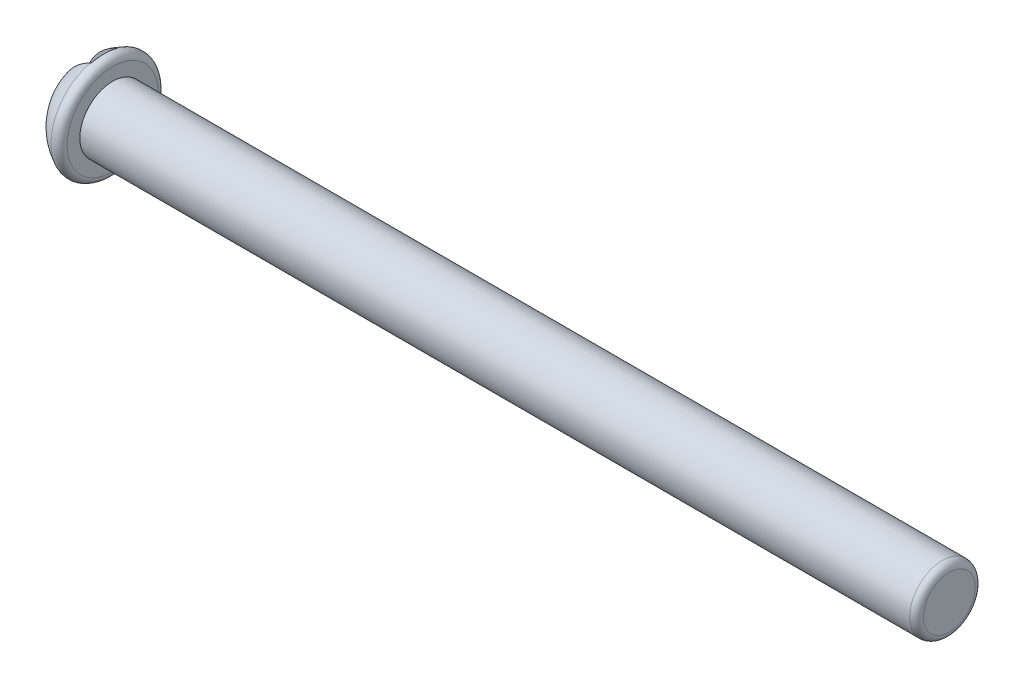
from build123d import *

# Parameters (mm, degrees)
CUT_EXTRUDE1_DEPTH = 1
FILLET1_R          = 0.2


with BuildPart() as part:
    # Sketch1 → Revolve1 (revolve)
    with BuildSketch(Plane(origin=(0, 0, 0), x_dir=(1, 0, 0), z_dir=(0, 1, 0))):
        with BuildLine():
            Line((0, 0), (25.5, 0))
            Line((25.5, 0), (25.5, 0.95))
            Line((25.5, 0.95), (1.25, 0.95))
            Line((1.25, 0.95), (1.25, 1.6))
            ThreePointArc((1.25, 1.6), (0.349547808, 1.015197025), (0, 0))
        make_face()
    revolve(axis=Axis((0, 0, 0), (1, 0, 0)))

    # Sketch2 → Cut-Extrude1 (cut)
    with BuildSketch(Plane(origin=(0, 0, 0), x_dir=(0, 0, -1), z_dir=(1, 0, 0))):
        with BuildLine():
            Line((0.375, -1.925921717), (-0.375, -1.925921717))
            Line((-0.375, -1.925921717), (-0.375, -0.649519053))
            ThreePointArc((-0.375, -0.649519053), (-0.75, 0), (-0.375, 0.649519053))
            Line((-0.375, 0.649519053), (-0.375, 1.925921717))
            Line((-0.375, 1.925921717), (0.375, 1.925921717))
            Line((0.375, 1.925921717), (0.375, 0.649519053))
            ThreePointArc((0.375, 0.649519053), (0.75, 0), (0.375, -0.649519053))
            Line((0.375, -0.649519053), (0.375, -1.925921717))
        make_face()
    extrude(amount=CUT_EXTRUDE1_DEPTH, mode=Mode.SUBTRACT)

    # Fillet1
    # the kernel refuses this fillet: 0.2 mm, written as the material it takes off along each edge
    with BuildSketch(Plane(origin=(25.5, 0, 0), x_dir=(0, 0, -1), z_dir=(0, -1, 0))) as fillet1_piece_1:
        with BuildLine():
            CenterArc((0.95 - FILLET1_R, -FILLET1_R), FILLET1_R, 0, 90)
            Line((0.95, -FILLET1_R), (0.95, 0))
            Line((0.95, 0), (0.95 - FILLET1_R, 0))
        make_face()
    revolve(axis=Axis((25.5, 0, 0), (1, 0, 0)), mode=Mode.SUBTRACT)
    with BuildSketch(Plane(origin=(1.25, 0, 0), x_dir=(0, 0, -1), z_dir=(0, -1, 0))) as fillet1_piece_2:
        with BuildLine():
            CenterArc((1.3193938, -0.2), FILLET1_R, 335.582123666, 114.417876334)
            ThreePointArc((1.501504746, -0.282677709), (1.557180013, -0.143578479), (1.6, 0))
            Line((1.6, 0), (1.3193938, 0))
        make_face()
    revolve(axis=Axis((1.25, 0, 0), (1, 0, 0)), mode=Mode.SUBTRACT)


solid = part.part
